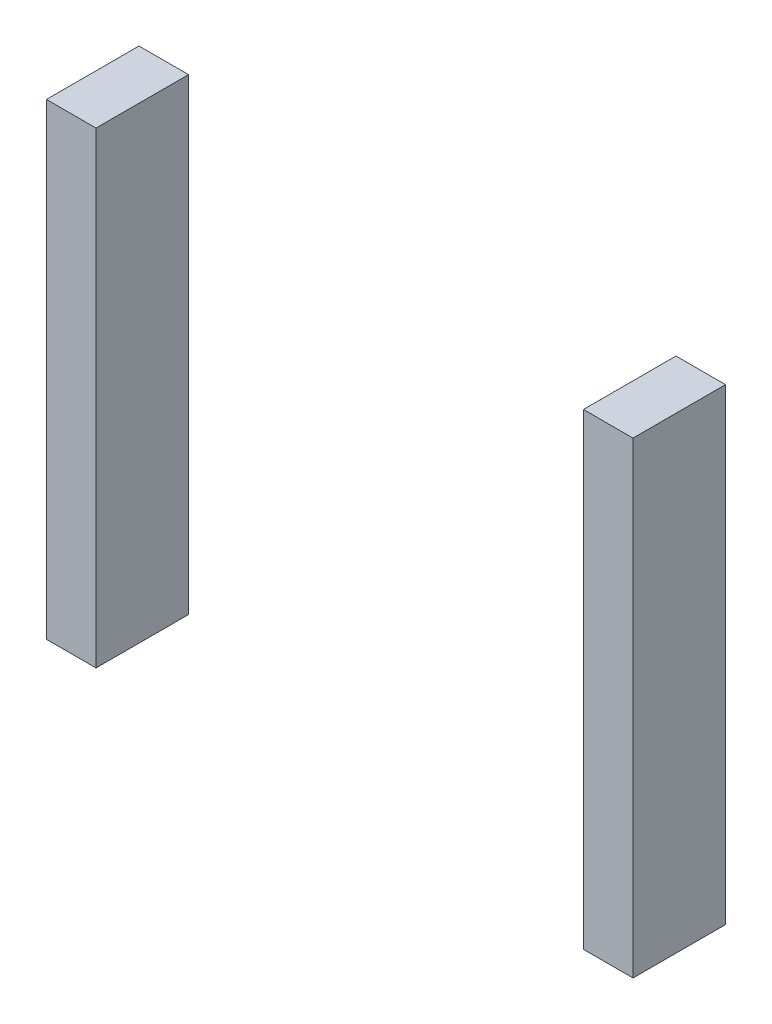
from build123d import *

# Parameters (mm, degrees)
SKETCH1_W                 = 4400
SKETCH1_H                 = 2900
BOSS_EXTRUDE1_DEPTH       = 9000
BOSS_EXTRUDE2_START       = -9000
BOSS_EXTRUDE2_OUTLINE_W   = 4400
BOSS_EXTRUDE2_OUTLINE_H   = 2900
BOSS_EXTRUDE2_DEPTH       = 8440
BOSS_EXTRUDE2_START_2     = -560
BOSS_EXTRUDE2_2_DEPTH     = 560
BOSS_EXTRUDE2_3_OUTLINE_W = 300
BOSS_EXTRUDE2_3_OUTLINE_H = 2830
BOSS_EXTRUDE2_3_DEPTH     = 560


with BuildPart() as part:
    # Sketch1 → Boss-Extrude1 (new body)
    with BuildSketch(Plane.XY):
        with Locations((2200, 1450)):
            Rectangle(SKETCH1_W, SKETCH1_H)
    extrude(amount=-BOSS_EXTRUDE1_DEPTH)

    # Boss-Extrude2: read off the stored shape, not the designer's step
    # Boss-Extrude2 outline → Boss-Extrude2 (cut)
    with BuildSketch(Plane.XY.offset(BOSS_EXTRUDE2_START)):
        with Locations((2200, 1450)):
            Rectangle(BOSS_EXTRUDE2_OUTLINE_W, BOSS_EXTRUDE2_OUTLINE_H)
    extrude(amount=BOSS_EXTRUDE2_DEPTH, mode=Mode.SUBTRACT)

    # Boss-Extrude2 2 outline → Boss-Extrude2 2 (cut)
    with BuildSketch(Plane.XY.offset(BOSS_EXTRUDE2_START_2)):
        Polygon((3720, 0), (3720, 2830), (4020, 2830), (4020, 0), (4400, 0), (4400, 2900), (0, 2900), (0, 0), align=None)
    extrude(amount=BOSS_EXTRUDE2_2_DEPTH, mode=Mode.SUBTRACT)


with BuildPart() as body_2:
    # Boss-Extrude2 3 outline → Boss-Extrude2 3 (new body)
    with BuildSketch(Plane.XY.offset(BOSS_EXTRUDE2_START_2)):
        with Locations((620, 1415)):
            Rectangle(BOSS_EXTRUDE2_3_OUTLINE_W, BOSS_EXTRUDE2_3_OUTLINE_H)
    extrude(amount=BOSS_EXTRUDE2_3_DEPTH)


solid = Compound([part.part, body_2.part])
